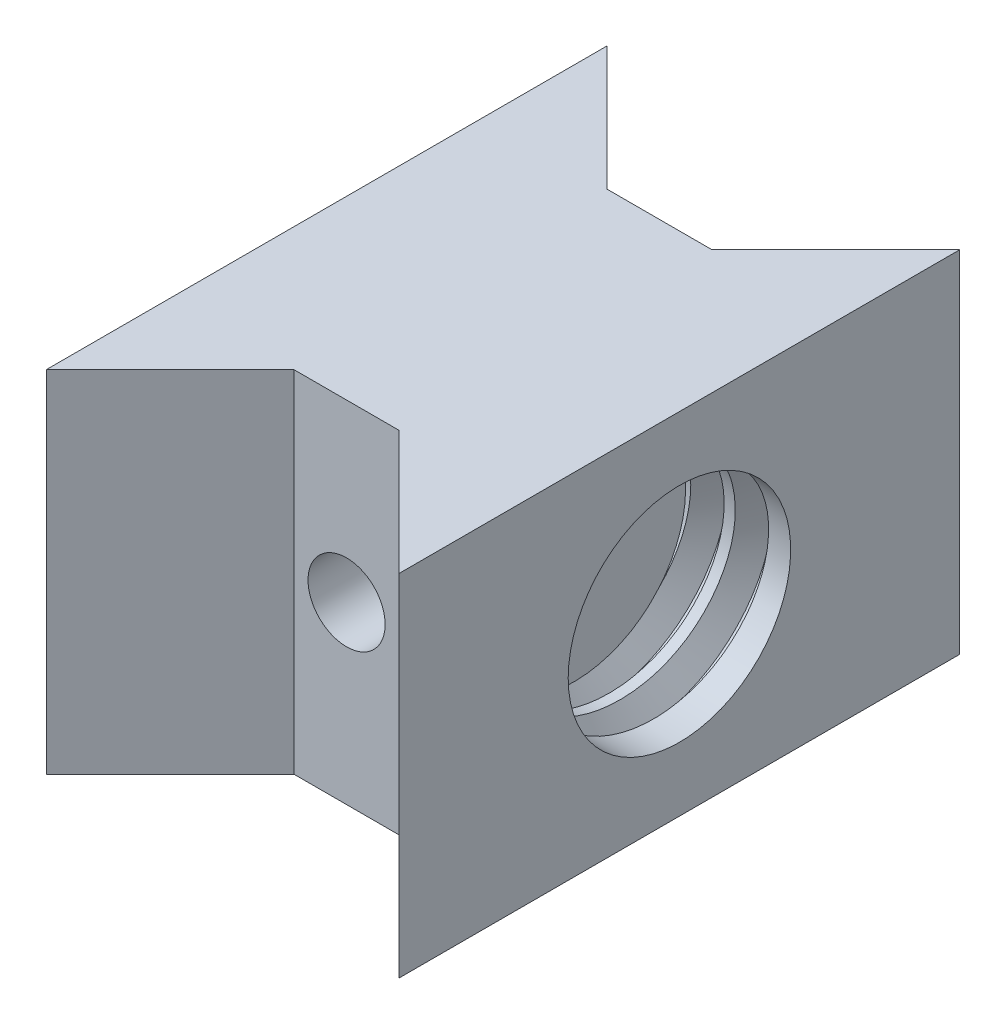
from build123d import *
from build123d.topology import SkipClean

# Parameters (mm, degrees)
BOSS_EXTRUDE1_DEPTH = 10
SKETCH8_R           = 1.1
CUT_EXTRUDE3_DEPTH  = 19.888867671
SKETCH3_R           = 3.175
CUT_EXTRUDE4_DEPTH  = 3
THREAD3_PITCH       = 1.27
THREAD4_PITCH       = 1.27


with BuildPart() as part:
    # Sketch1 → Boss-Extrude1 (new body)
    with BuildSketch(Plane(origin=(0, 0, 0), x_dir=(1, 0, 0), z_dir=(0, 1, 0))):
        Polygon((0, 0), (0, 8), (-3.535533906, 4.464466094), (-6.535533906, 4.464466094), (-10.071067812, 8), (-10.071067812, -8), (-6.535533906, -4.464466094), (-3.535533906, -4.464466094), (0, -8), align=None)
    extrude(amount=BOSS_EXTRUDE1_DEPTH)

    # Sketch8 → Cut-Extrude3 (cut, through all)
    with BuildSketch(Plane.XY.offset(4.464466094)):
        with Locations((-5.035533906, 5)):
            Circle(SKETCH8_R)
    extrude(amount=-CUT_EXTRUDE3_DEPTH, mode=Mode.SUBTRACT)

    # Sketch3 → Cut-Extrude4 (cut)
    with BuildSketch(Plane(origin=(0, 0, 0), x_dir=(0, 0, -1), z_dir=(1, 0, 0))):
        with Locations((0, 5)):
            Circle(SKETCH3_R)
    cut_extrude4 = extrude(amount=-CUT_EXTRUDE4_DEPTH, mode=Mode.SUBTRACT)

    # Mirror2: Cut-Extrude4 across plane
    add(cut_extrude4.mirror(Plane(origin=(-5.035533906, 0, 0), x_dir=(0, 0, 1), z_dir=(1, 0, 0))), mode=Mode.SUBTRACT)

    # Thread3: the profile of Thread Profile3 profile screwed along a right-hand helix of 2.362205 turns, 8 arcs to a turn; built about Z, then put on its axis
    with SkipClean():  # the faces are left unmerged after this step: merging them gives an invalid solid
        thread3_z = Axis((0, 0, 0), (0, 0, 1))
        thread3_corners = [(3.1747, 0, -0.000173205), (3.862407661, 0, 0.396874998), (3.862407661, 0, 0.555624998), (3.1747, 0, 0.952673202)]
        with BuildLine(mode=Mode.PRIVATE) as thread3_profile:
            Line(thread3_corners[0], thread3_corners[1])
            Line(thread3_corners[1], thread3_corners[2])
            Line(thread3_corners[2], thread3_corners[3])
            Line(thread3_corners[3], thread3_corners[0])
        thread3_cap = Face(thread3_profile.wire())
        thread3_turn_angles = [0, 22.5, 45, 67.5, 90, 112.5, 135, 157.5, 180, 202.5, 225, 247.5, 270, 292.5, 315, 337.5, 360]
        thread3_turn_weights = [1, 0.9238795325112867, 1, 0.9238795325112867, 1, 0.9238795325112867, 1, 0.9238795325112867, 1, 0.9238795325112867, 1, 0.9238795325112867, 1, 0.9238795325112867, 1, 0.9238795325112867, 1]
        thread3_turn_rails = [Edge.make_bspline([Vector(p[0], p[1], 0).rotate(thread3_z, thread3_turn_angles[k]) / thread3_turn_weights[k] + Vector(0, 0, p[2] + THREAD3_PITCH * thread3_turn_angles[k] / 360) for k in range(17)], [0, 0, 0, 1, 1, 2, 2, 3, 3, 4, 4, 5, 5, 6, 6, 7, 7, 8, 8, 8], 2, thread3_turn_weights) for p in thread3_corners]
        thread3_turn_sides = [Face.make_surface_from_curves(thread3_turn_rails[p[0]], thread3_turn_rails[p[1]]) for p in [(0, 1), (1, 2), (2, 3), (3, 0)]]
        thread3_last_angles = [720, 742.5, 765, 787.5, 810, 830.196850394, 850.393700787]
        thread3_last_weights = [1, 0.9238795325112867, 1, 0.9238795325112867, 1, 0.9385120027288909, 1]
        thread3_last_rails = [Edge.make_bspline([Vector(p[0], p[1], 0).rotate(thread3_z, thread3_last_angles[k]) / thread3_last_weights[k] + Vector(0, 0, p[2] + THREAD3_PITCH * thread3_last_angles[k] / 360) for k in range(7)], [0, 0, 0, 1, 1, 2, 2, 3, 3, 3], 2, thread3_last_weights) for p in thread3_corners]
        thread3_last_sides = [Face.make_surface_from_curves(thread3_last_rails[p[0]], thread3_last_rails[p[1]]) for p in [(0, 1), (1, 2), (2, 3), (3, 0)]]
        thread3 = Plane(origin=(0, 5, 0), x_dir=(0, 0, 1), z_dir=(-1, 0, 0)) * Solid(Shell([*[p.moved(Location((0, 0, THREAD3_PITCH * i))) for i in range(2) for p in thread3_turn_sides], *thread3_last_sides, thread3_cap, thread3_cap.rotate(thread3_z, 850.393700787).moved(Location((0, 0, THREAD3_PITCH * 850.393700787 / 360)))]))
        add(thread3, mode=Mode.SUBTRACT)

    # Thread4: the profile of Thread Profile4 profile screwed along a right-hand helix of 2.362205 turns, 8 arcs to a turn; built about Z, then put on its axis
    with SkipClean():  # the faces are left unmerged after this step: merging them gives an invalid solid
        thread4_z = Axis((0, 0, 0), (0, 0, 1))
        thread4_corners = [(3.1747, 0, -0.000173205), (3.862407661, 0, 0.396874998), (3.862407661, 0, 0.555624998), (3.1747, 0, 0.952673202)]
        with BuildLine(mode=Mode.PRIVATE) as thread4_profile:
            Line(thread4_corners[0], thread4_corners[1])
            Line(thread4_corners[1], thread4_corners[2])
            Line(thread4_corners[2], thread4_corners[3])
            Line(thread4_corners[3], thread4_corners[0])
        thread4_cap = Face(thread4_profile.wire())
        thread4_turn_angles = [0, 22.5, 45, 67.5, 90, 112.5, 135, 157.5, 180, 202.5, 225, 247.5, 270, 292.5, 315, 337.5, 360]
        thread4_turn_weights = [1, 0.9238795325112867, 1, 0.9238795325112867, 1, 0.9238795325112867, 1, 0.9238795325112867, 1, 0.9238795325112867, 1, 0.9238795325112867, 1, 0.9238795325112867, 1, 0.9238795325112867, 1]
        thread4_turn_rails = [Edge.make_bspline([Vector(p[0], p[1], 0).rotate(thread4_z, thread4_turn_angles[k]) / thread4_turn_weights[k] + Vector(0, 0, p[2] + THREAD4_PITCH * thread4_turn_angles[k] / 360) for k in range(17)], [0, 0, 0, 1, 1, 2, 2, 3, 3, 4, 4, 5, 5, 6, 6, 7, 7, 8, 8, 8], 2, thread4_turn_weights) for p in thread4_corners]
        thread4_turn_sides = [Face.make_surface_from_curves(thread4_turn_rails[p[0]], thread4_turn_rails[p[1]]) for p in [(0, 1), (1, 2), (2, 3), (3, 0)]]
        thread4_last_angles = [720, 742.5, 765, 787.5, 810, 830.196850394, 850.393700787]
        thread4_last_weights = [1, 0.9238795325112867, 1, 0.9238795325112867, 1, 0.9385120027288909, 1]
        thread4_last_rails = [Edge.make_bspline([Vector(p[0], p[1], 0).rotate(thread4_z, thread4_last_angles[k]) / thread4_last_weights[k] + Vector(0, 0, p[2] + THREAD4_PITCH * thread4_last_angles[k] / 360) for k in range(7)], [0, 0, 0, 1, 1, 2, 2, 3, 3, 3], 2, thread4_last_weights) for p in thread4_corners]
        thread4_last_sides = [Face.make_surface_from_curves(thread4_last_rails[p[0]], thread4_last_rails[p[1]]) for p in [(0, 1), (1, 2), (2, 3), (3, 0)]]
        thread4 = Plane(origin=(-10.071067812, 5, 0), x_dir=(0, 0, -1), z_dir=(1, 0, 0)) * Solid(Shell([*[p.moved(Location((0, 0, THREAD4_PITCH * i))) for i in range(2) for p in thread4_turn_sides], *thread4_last_sides, thread4_cap, thread4_cap.rotate(thread4_z, 850.393700787).moved(Location((0, 0, THREAD4_PITCH * 850.393700787 / 360)))]))
        add(thread4, mode=Mode.SUBTRACT)


solid = part.part
